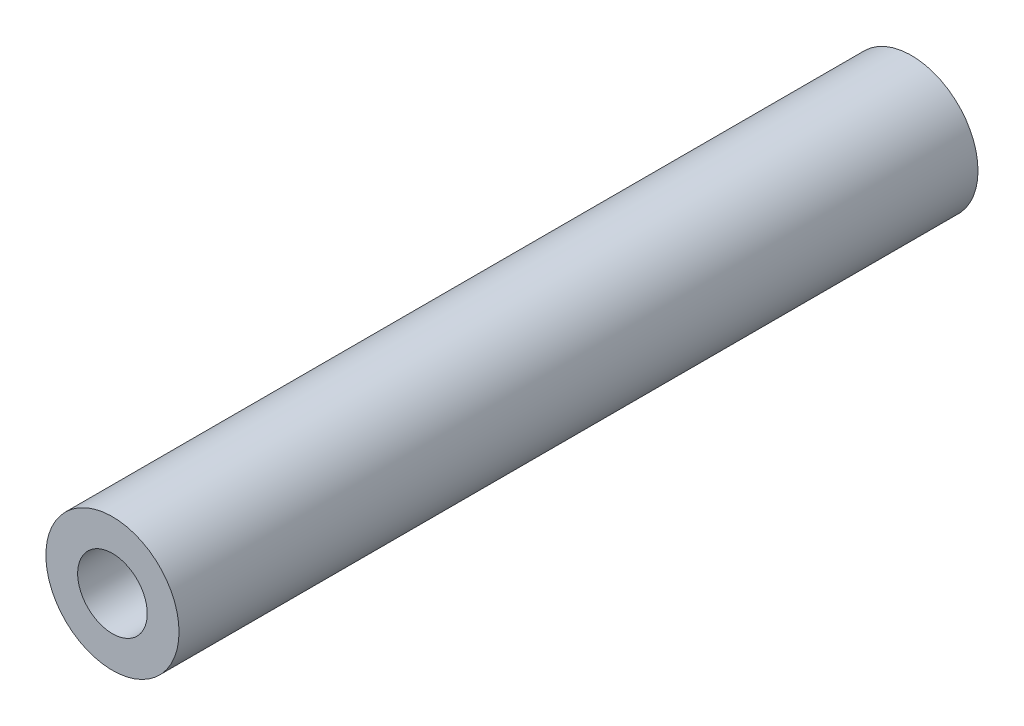
from build123d import *

# Parameters (mm, degrees)
SKETCH1_R           = 4.7625
SKETCH1_R_2         = 2.4892
BOSS_EXTRUDE1_DEPTH = 57.15


with BuildPart() as part:
    # Sketch1 → Boss-Extrude1 (new body)
    with BuildSketch(Plane.XY):
        Circle(SKETCH1_R)
        Circle(SKETCH1_R_2, mode=Mode.SUBTRACT)
    extrude(amount=BOSS_EXTRUDE1_DEPTH)


solid = part.part
